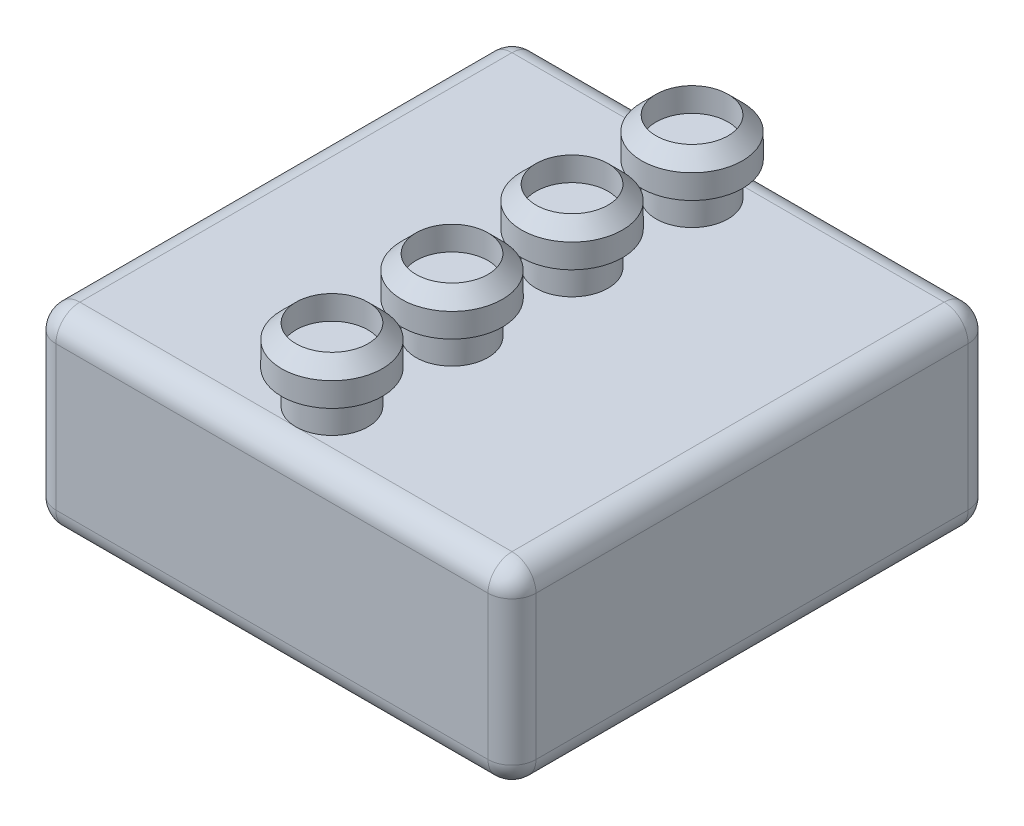
from build123d import *

# Parameters (mm, degrees)
SKETCH1_W           = 100
SKETCH1_H           = 100
BOSS_EXTRUDE1_DEPTH = 40
SKETCH2_R           = 7.5
BOSS_EXTRUDE2_DEPTH = 10
BOSS_EXTRUDE3_START = 7
SKETCH2_4_R         = 10.5
SKETCH2_4_R_2       = 7.5
BOSS_EXTRUDE3_DEPTH = 10
CHAMFER1_SIZE       = 1
CHAMFER2_SIZE       = 5
FILLET1_R           = 5


# Some blends are built 0.0001 mm under size
with BuildPart() as part:
    # Sketch1 → Boss-Extrude1 (new body)
    with BuildSketch(Plane(origin=(0, 0, 0), x_dir=(1, 0, 0), z_dir=(0, 1, 0))):
        Rectangle(SKETCH1_W, SKETCH1_H)
    extrude(amount=BOSS_EXTRUDE1_DEPTH)

    # Sketch2 → Boss-Extrude2 (add)
    with BuildSketch(Plane(origin=(0, 40, 0), x_dir=(1, 0, 0), z_dir=(0, 1, 0))):
        with Locations(Location((0, -37.5, 0), (0, 0, 90))):
            Circle(SKETCH2_R)
        with Locations(Location((0, -12.5, 0), (0, 0, 90))):
            Circle(SKETCH2_R)
        with Locations(Location((0, 12.5, 0), (0, 0, 90))):
            Circle(SKETCH2_R)
        with Locations(Location((0, 37.5, 0), (0, 0, 90))):
            Circle(SKETCH2_R)
    extrude(amount=BOSS_EXTRUDE2_DEPTH)

    # Sketch2<4> → Boss-Extrude3 (add)
    # profile 1 of 4: a face of its own
    with BuildSketch(Plane(origin=(0, 40, 0), x_dir=(1, 0, 0), z_dir=(0, 1, 0)).offset(BOSS_EXTRUDE3_START)):
        with Locations(Location((0, -37.5, 0), (0, 0, 270))):
            Circle(SKETCH2_4_R)
        with Locations(Location((0, -37.5, 0), (0, 0, 90))):
            Circle(SKETCH2_4_R_2, mode=Mode.SUBTRACT)
    # profile 2 of 4: a face of its own
    with BuildSketch(Plane(origin=(0, 40, 0), x_dir=(1, 0, 0), z_dir=(0, 1, 0)).offset(BOSS_EXTRUDE3_START)):
        with Locations(Location((0, -12.5, 0), (0, 0, 270))):
            Circle(SKETCH2_4_R)
        with Locations(Location((0, -12.5, 0), (0, 0, 90))):
            Circle(SKETCH2_4_R_2, mode=Mode.SUBTRACT)
    # profile 3 of 4: a face of its own
    with BuildSketch(Plane(origin=(0, 40, 0), x_dir=(1, 0, 0), z_dir=(0, 1, 0)).offset(BOSS_EXTRUDE3_START)):
        with Locations(Location((0, 12.5, 0), (0, 0, 270))):
            Circle(SKETCH2_4_R)
        with Locations(Location((0, 12.5, 0), (0, 0, 90))):
            Circle(SKETCH2_4_R_2, mode=Mode.SUBTRACT)
    # profile 4 of 4: a face of its own
    with BuildSketch(Plane(origin=(0, 40, 0), x_dir=(1, 0, 0), z_dir=(0, 1, 0)).offset(BOSS_EXTRUDE3_START)):
        with Locations(Location((0, 37.5, 0), (0, 0, 270))):
            Circle(SKETCH2_4_R)
        with Locations(Location((0, 37.5, 0), (0, 0, 90))):
            Circle(SKETCH2_4_R_2, mode=Mode.SUBTRACT)
    extrude(amount=BOSS_EXTRUDE3_DEPTH)

    # Chamfer1
    chamfer1_edges = [part.edges().sort_by_distance(p)[0] for p in [
        (0, 47, 45),
        (0, 47, 20),
        (0, 47, -5),
        (0, 47, -30),
    ]]
    chamfer(chamfer1_edges, length=CHAMFER1_SIZE)

    # Chamfer2
    # the kernel refuses this chamfer: 5 mm, written as the material it takes off along each edge
    with BuildSketch(Plane(origin=(0, 57, -37.5), x_dir=(0, 0, 1), z_dir=(-1, 0, 0))) as chamfer2_piece_1:
        Polygon((10.5, -CHAMFER2_SIZE), (10.5 - CHAMFER2_SIZE, 0), (10.5, 0), align=None)
    revolve(axis=Axis((0, 57, -37.5), (0, 1, 0)), mode=Mode.SUBTRACT)
    with BuildSketch(Plane(origin=(0, 57, -12.5), x_dir=(0, 0, 1), z_dir=(-1, 0, 0))) as chamfer2_piece_2:
        Polygon((10.5, -CHAMFER2_SIZE), (10.5 - CHAMFER2_SIZE, 0), (10.5, 0), align=None)
    revolve(axis=Axis((0, 57, -12.5), (0, 1, 0)), mode=Mode.SUBTRACT)
    with BuildSketch(Plane(origin=(0, 57, 12.5), x_dir=(0, 0, 1), z_dir=(-1, 0, 0))) as chamfer2_piece_3:
        Polygon((10.5, -CHAMFER2_SIZE), (10.5 - CHAMFER2_SIZE, 0), (10.5, 0), align=None)
    revolve(axis=Axis((0, 57, 12.5), (0, 1, 0)), mode=Mode.SUBTRACT)
    with BuildSketch(Plane(origin=(0, 57, 37.5), x_dir=(0, 0, 1), z_dir=(-1, 0, 0))) as chamfer2_piece_4:
        Polygon((10.5, -CHAMFER2_SIZE), (10.5 - CHAMFER2_SIZE, 0), (10.5, 0), align=None)
    revolve(axis=Axis((0, 57, 37.5), (0, 1, 0)), mode=Mode.SUBTRACT)

    # Fillet1
    fillet1_edges = [part.edges().sort_by_distance(p)[0] for p in [
        (-50, 40, 0),
        (0, 40, 50),
        (50, 40, 0),
        (0, 0, 50),
        (-50, 0, 0),
        (0, 0, -50),
        (50, 0, 0),
        (50, 20, 50),
        (-50, 20, 50),
        (-50, 20, -50),
        (50, 20, -50),
        (0, 40, -50),
    ]]
    fillet(fillet1_edges, radius=FILLET1_R - 0.0001)  # a hair under: the kernel refuses the full size


solid = part.part
